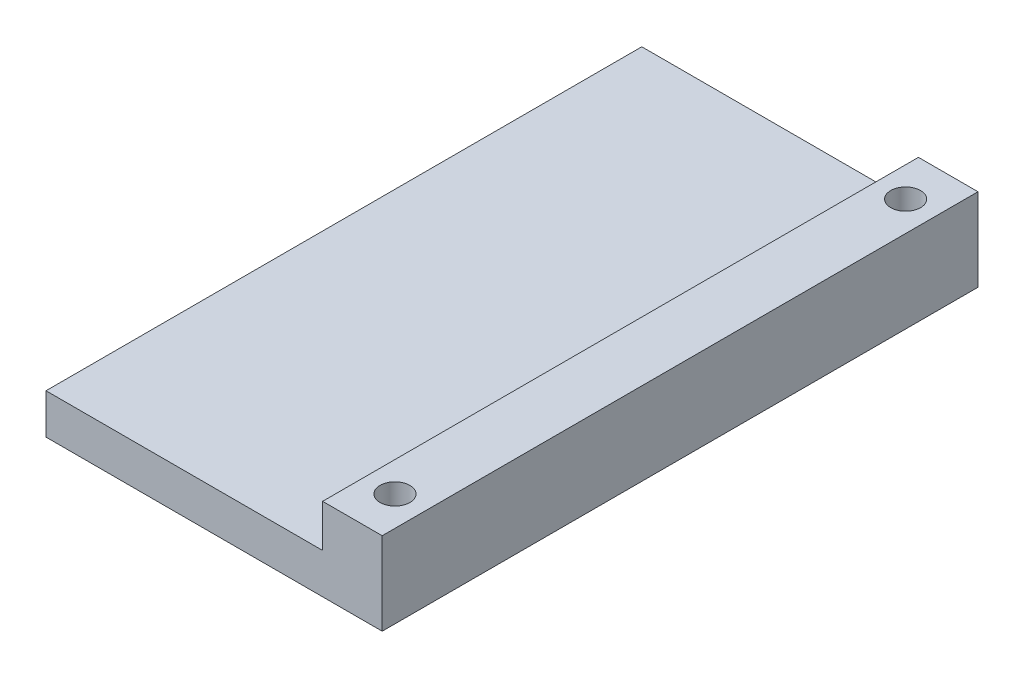
from build123d import *

# Parameters (mm, degrees)
SKETCH1_W               = 41.275
SKETCH1_H               = 88.9
BOSS_EXTRUDE1_DEPTH     = 5.9944
SKETCH1_5_W             = 8.89
SKETCH1_5_H             = 88.9
BOSS_EXTRUDE2_DEPTH     = 12.3444
CUT_EXTRUDE1_DEPTH      = 103.820821998
CUT_EXTRUDE1_DEPTH_BACK = 103.820821998
SKETCH3_R               = 2.2225
SKETCH4_R               = 3.683
CUT_EXTRUDE2_DEPTH      = 4.064


with BuildPart() as part:
    # Sketch1 → Boss-Extrude1 (new body)
    with BuildSketch(Plane(origin=(0, 0, 0), x_dir=(1, 0, 0), z_dir=(0, 1, 0))):
        with Locations((20.6375, 44.45)):
            Rectangle(SKETCH1_W, SKETCH1_H)
    extrude(amount=BOSS_EXTRUDE1_DEPTH)

    # Sketch1<5> → Boss-Extrude2 (add)
    with BuildSketch(Plane(origin=(0, 0, 0), x_dir=(1, 0, 0), z_dir=(0, 1, 0))):
        with Locations((45.72, 44.45)):
            Rectangle(SKETCH1_5_W, SKETCH1_5_H)
    extrude(amount=BOSS_EXTRUDE2_DEPTH)

    # Sketch3 → Cut-Extrude1 (cut, two sides: drawn at the far end of the back side and taken through both)
    with BuildSketch(Plane(origin=(0, 12.3444, 0), x_dir=(1, 0, 0), z_dir=(0, 1, 0)).offset(-CUT_EXTRUDE1_DEPTH_BACK)):
        with Locations((45.72, 82.55)):
            Circle(SKETCH3_R)
        with Locations((45.72, 6.35)):
            Circle(SKETCH3_R)
    extrude(amount=CUT_EXTRUDE1_DEPTH + CUT_EXTRUDE1_DEPTH_BACK, mode=Mode.SUBTRACT)

    # Sketch4 → Cut-Extrude2 (cut)
    with BuildSketch(Plane.XZ):
        with Locations((45.72, -6.35)):
            Circle(SKETCH4_R)
        with Locations((45.72, -82.55)):
            Circle(SKETCH4_R)
    extrude(amount=-CUT_EXTRUDE2_DEPTH, mode=Mode.SUBTRACT)


solid = part.part
